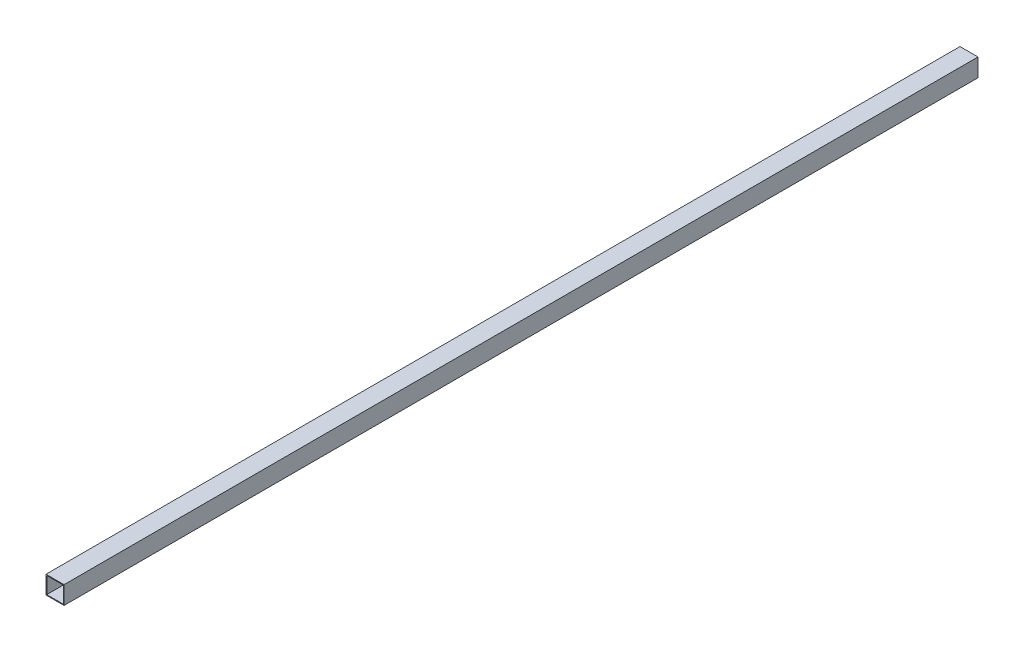
from build123d import *

# Parameters (mm, degrees)
SKETCH2_W           = 38.1
SKETCH2_H           = 38.1
SKETCH2_W_2         = 34.925
SKETCH2_H_2         = 34.925
BOSS_EXTRUDE1_DEPTH = 1930.4


with BuildPart() as part:
    # Sketch2 → Boss-Extrude1 (new body)
    with BuildSketch(Plane.XY):
        with Locations((19.05, 19.05)):
            Rectangle(SKETCH2_W, SKETCH2_H)
        with Locations((19.05, 19.05)):
            Rectangle(SKETCH2_W_2, SKETCH2_H_2, mode=Mode.SUBTRACT)
    extrude(amount=BOSS_EXTRUDE1_DEPTH)


solid = part.part
